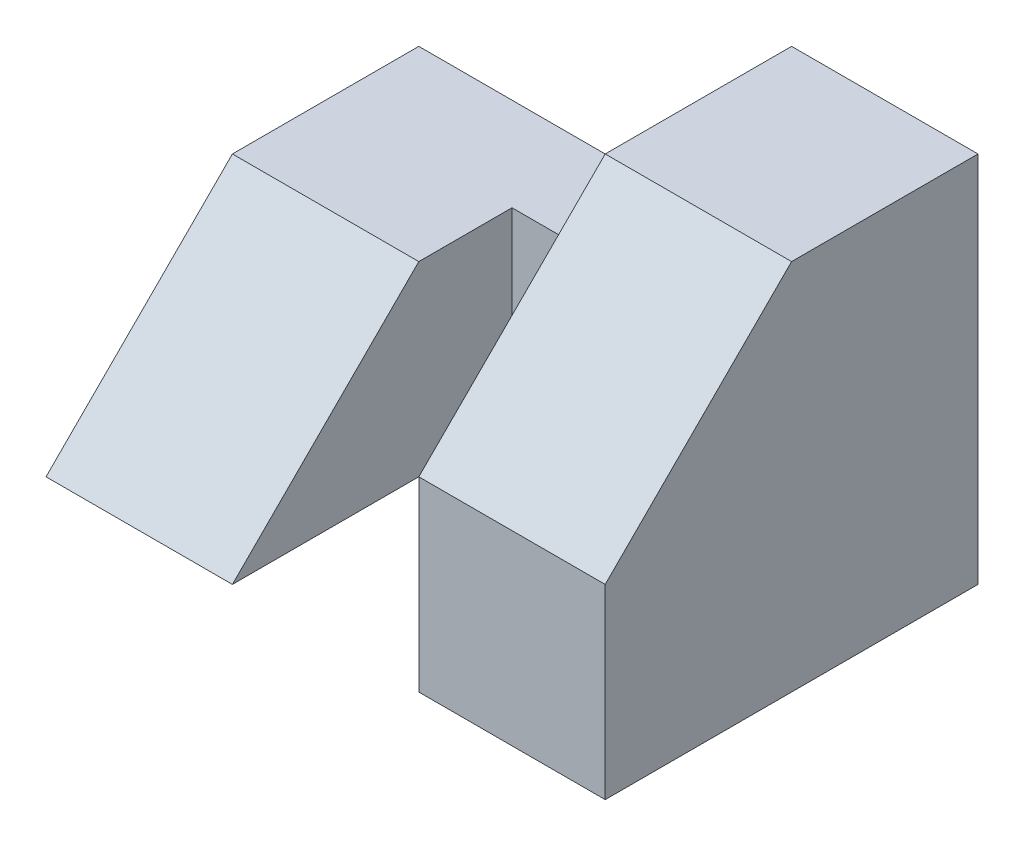
from build123d import *

# Parameters (mm, degrees)
SKETCH2_W           = 152.4
SKETCH2_H           = 101.6
BOSS_EXTRUDE1_DEPTH = 50.8
SKETCH4_W           = 101.6
SKETCH4_H           = 50.8
CUT_EXTRUDE1_DEPTH  = 137.783186101
SKETCH5_W           = 50.8
SKETCH5_H           = 76.2
CUT_EXTRUDE2_DEPTH  = 105.726882891
CHAMFER1_SIZE       = 50.8


with BuildPart() as part:
    # Sketch2 → Boss-Extrude1 (new, symmetric)
    with BuildSketch(Plane.XY):
        Rectangle(SKETCH2_W, SKETCH2_H)
    extrude(amount=BOSS_EXTRUDE1_DEPTH, both=True)

    # Sketch4 → Cut-Extrude1 (cut, through all)
    with BuildSketch(Plane.XY.offset(50.8)):
        with Locations((-25.4, 25.4)):
            Rectangle(SKETCH4_W, SKETCH4_H)
    extrude(amount=-CUT_EXTRUDE1_DEPTH, mode=Mode.SUBTRACT)

    # Sketch5 → Cut-Extrude2 (cut, through all)
    with BuildSketch(Plane(origin=(0, 0, 0), x_dir=(1, 0, 0), z_dir=(0, 1, 0))):
        with Locations((0, -12.7)):
            Rectangle(SKETCH5_W, SKETCH5_H)
    extrude(amount=-CUT_EXTRUDE2_DEPTH, mode=Mode.SUBTRACT)

    # Chamfer1
    chamfer1_edges = [part.edges().sort_by_distance(p)[0] for p in [
        (-50.8, 0, 50.8),
        (50.8, 50.8, 50.8),
    ]]
    chamfer(chamfer1_edges, length=CHAMFER1_SIZE - 0.0001)  # a hair under: the kernel refuses the full size


solid = part.part
